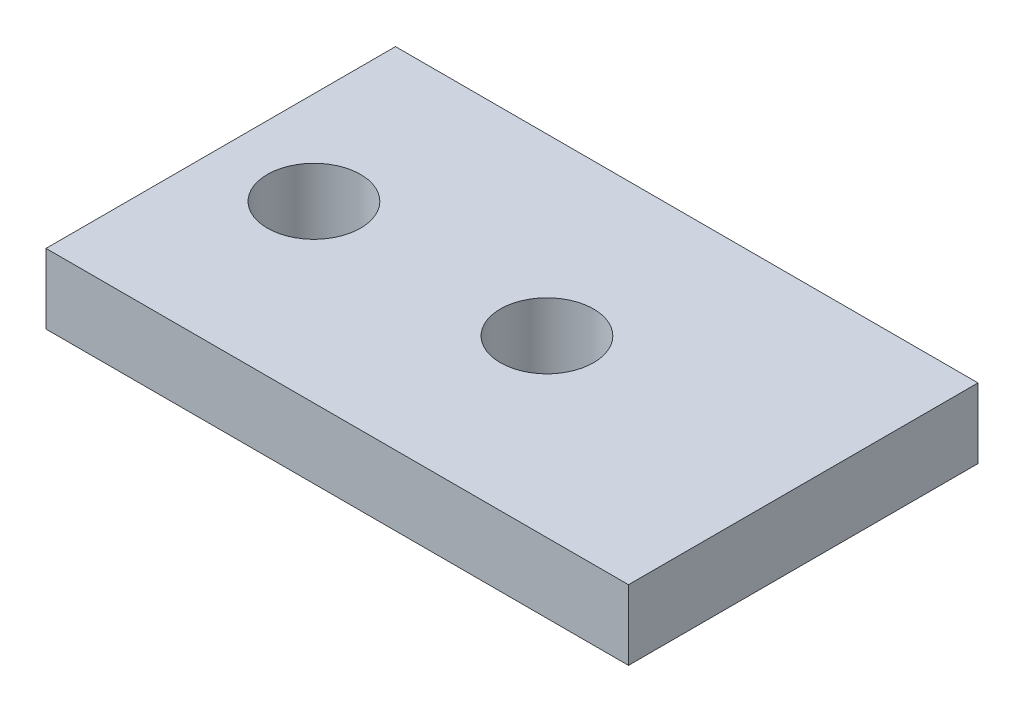
from build123d import *

# Parameters (mm, degrees)
SKETCH_2_W      = 50
SKETCH_2_H      = 30
SKETCH_2_R      = 4
EXTRUDE_1_DEPTH = 6


with BuildPart() as part:
    # Эскиз2 → Бобышка-Вытянуть1 (new body)
    with BuildSketch(Plane(origin=(0, 0, 0), x_dir=(1, 0, 0), z_dir=(0, 1, 0))):
        Rectangle(SKETCH_2_W, SKETCH_2_H)
        with Locations((3, 0)):
            Circle(SKETCH_2_R, mode=Mode.SUBTRACT)
        with Locations((-17, 0)):
            Circle(SKETCH_2_R, mode=Mode.SUBTRACT)
    extrude(amount=EXTRUDE_1_DEPTH)


solid = part.part
